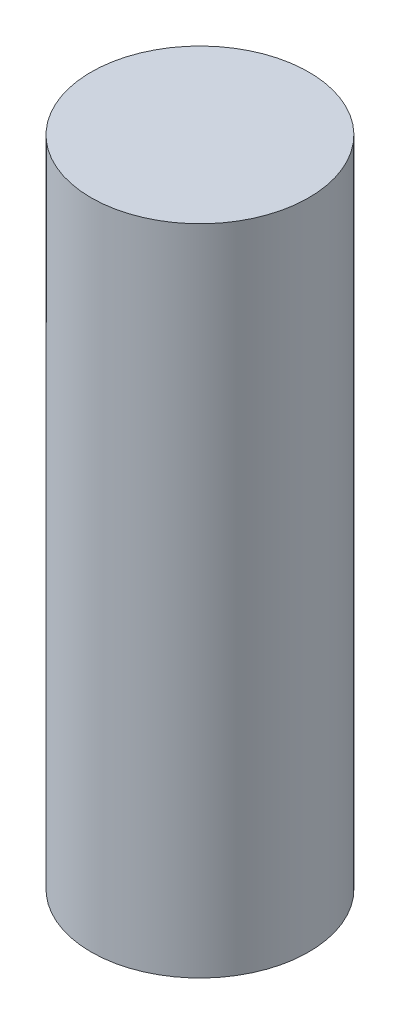
from build123d import *

# Parameters (mm, degrees)
SKETCH1_R           = 5
BOSS_EXTRUDE1_DEPTH = 30
SKETCH2_W           = 2.8
SKETCH2_H           = 2.8
CUT_EXTRUDE1_DEPTH  = 3


with BuildPart() as part:
    # Sketch1 → Boss-Extrude1 (new body)
    with BuildSketch(Plane(origin=(0, 0, 0), x_dir=(1, 0, 0), z_dir=(0, 1, 0))):
        Circle(SKETCH1_R)
    extrude(amount=BOSS_EXTRUDE1_DEPTH)

    # Sketch2 → Cut-Extrude1 (cut)
    with BuildSketch(Plane.XZ):
        Rectangle(SKETCH2_W, SKETCH2_H)
    extrude(amount=-CUT_EXTRUDE1_DEPTH, mode=Mode.SUBTRACT)


solid = part.part
